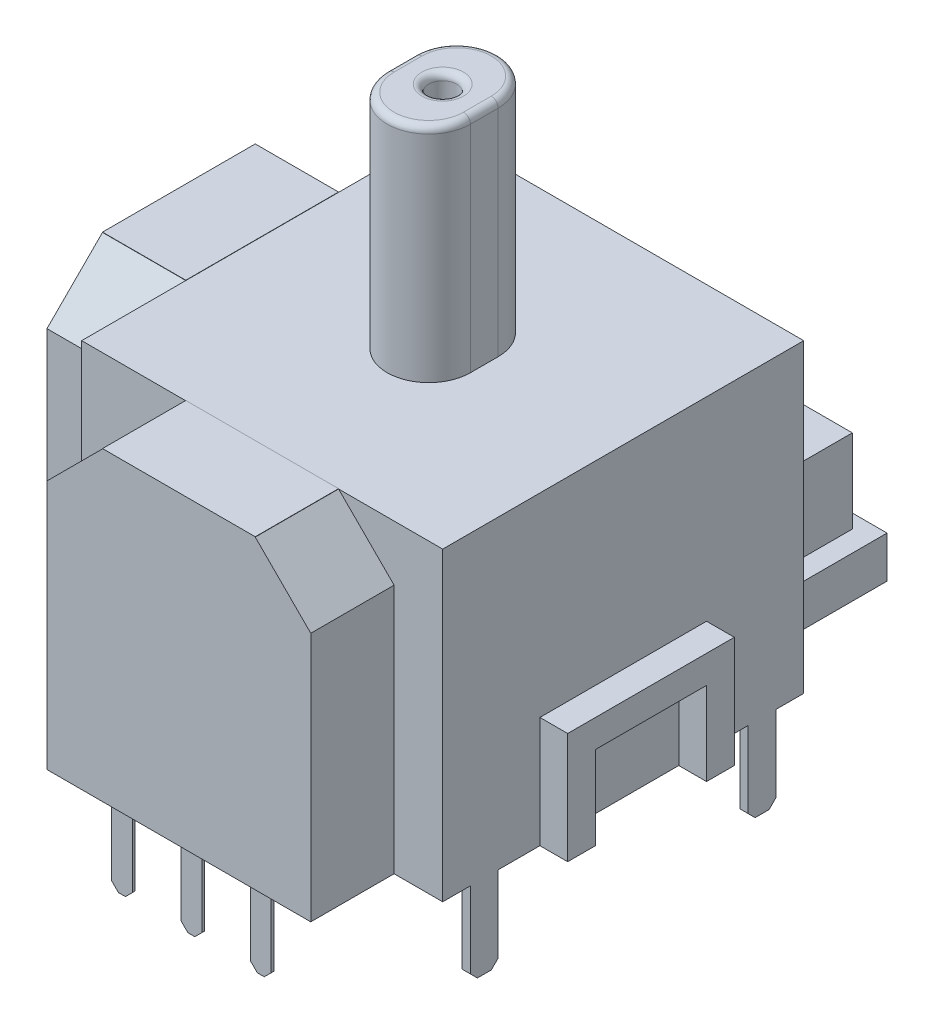
from build123d import *

# Parameters (mm, degrees)
SKETCH2_W           = 13
SKETCH2_H           = 11
BOSS_EXTRUDE1_DEPTH = 6.5
BOSS_EXTRUDE2_DEPTH = 1
SKETCH4_W           = 9.5
SKETCH4_H           = 11
BOSS_EXTRUDE3_DEPTH = 3
CHAMFER1_SIZE       = 2
SKETCH5_W           = 9.5
SKETCH5_H           = 11
BOSS_EXTRUDE4_DEPTH = 3
CHAMFER2_SIZE       = 2
SKETCH6_W           = 9
SKETCH6_H           = 1.5
BOSS_EXTRUDE5_DEPTH = 5
SKETCH7_W           = 7.5
SKETCH7_H           = 3
BOSS_EXTRUDE6_DEPTH = 4.5
SKETCH8_R           = 0.5
BOSS_EXTRUDE7_DEPTH = 8
FILLET2_R           = 0.25
SKETCH9_W           = 3
SKETCH9_H           = 5.5
SKETCH9_W_2         = 5.5
SKETCH9_H_2         = 3
BOSS_EXTRUDE8_DEPTH = 0.01
SKETCH10_W          = 0.3
SKETCH10_H          = 1
SKETCH10_W_2        = 0.1
SKETCH10_H_2        = 0.75
SKETCH10_W_3        = 0.75
SKETCH10_H_3        = 0.1
SKETCH10_W_4        = 0.25
SKETCH10_H_4        = 0.25
BOSS_EXTRUDE9_DEPTH = 3
CHAMFER3_SIZE       = 0.25
CHAMFER4_SIZE       = 0.1


with BuildPart() as part:
    # Sketch2 → Boss-Extrude1 (new, symmetric)
    with BuildSketch(Plane(origin=(0, 0, 0), x_dir=(0, 0, -1), z_dir=(1, 0, 0))):
        Rectangle(SKETCH2_W, SKETCH2_H)
    extrude(amount=BOSS_EXTRUDE1_DEPTH, both=True)

    # Sketch3 → Boss-Extrude2 (add)
    with BuildSketch(Plane(origin=(6.5, 0, 0), x_dir=(0, 0, -1), z_dir=(1, 0, 0))):
        Polygon((3, -1.5), (-3, -1.5), (-3, -5.5), (-2, -5.5), (-2, -2.5), (2, -2.5), (2, -5.5), (3, -5.5), align=None)
    extrude(amount=BOSS_EXTRUDE2_DEPTH)

    # Sketch4 → Boss-Extrude3 (add)
    with BuildSketch(Plane.XY.offset(6.5)):
        Rectangle(SKETCH4_W, SKETCH4_H)
    extrude(amount=BOSS_EXTRUDE3_DEPTH)

    # Chamfer1
    chamfer1_edges = [part.edges().sort_by_distance(p)[0] for p in [
        (4.75, 5.5, 8),
        (-4.75, 5.5, 8),
    ]]
    chamfer(chamfer1_edges, length=CHAMFER1_SIZE)

    # Sketch5 → Boss-Extrude4 (add)
    with BuildSketch(Plane.ZY.offset(6.5)):
        Rectangle(SKETCH5_W, SKETCH5_H)
    extrude(amount=BOSS_EXTRUDE4_DEPTH)

    # Chamfer2
    chamfer2_edges = [part.edges().sort_by_distance(p)[0] for p in [
        (-8, 5.5, -4.75),
        (-8, 5.5, 4.75),
    ]]
    chamfer(chamfer2_edges, length=CHAMFER2_SIZE)

    # Sketch6 → Boss-Extrude5 (add)
    with BuildSketch(Plane(origin=(0, 0, -6.5), x_dir=(-1, 0, 0), z_dir=(0, 0, -1))):
        with Locations((0, -4.75)):
            Rectangle(SKETCH6_W, SKETCH6_H)
    extrude(amount=BOSS_EXTRUDE5_DEPTH)

    # Sketch7 → Boss-Extrude6 (add)
    with BuildSketch(Plane(origin=(0, 0, -6.5), x_dir=(-1, 0, 0), z_dir=(0, 0, -1))):
        with Locations((0, -2.5)):
            Rectangle(SKETCH7_W, SKETCH7_H)
    extrude(amount=BOSS_EXTRUDE6_DEPTH)

    # Sketch8 → Boss-Extrude7 (add)
    with BuildSketch(Plane(origin=(0, 5.5, 0), x_dir=(1, 0, 0), z_dir=(0, 1, 0))):
        with BuildLine():
            Line((1.5, 0.5), (1.5, -0.5))
            ThreePointArc((1.5, -0.5), (0, -2), (-1.5, -0.5))
            Line((-1.5, -0.5), (-1.5, 0.5))
            ThreePointArc((-1.5, 0.5), (0, 2), (1.5, 0.5))
        make_face()
        Circle(SKETCH8_R, mode=Mode.SUBTRACT)
    extrude(amount=BOSS_EXTRUDE7_DEPTH)

    # Fillet2
    fillet2_edges = [part.edges().sort_by_distance(p)[0] for p in [
        (-0.5, 13.5, 0),
        (1.5, 13.5, 0),
        (0, 13.5, 2),
        (-1.5, 13.5, 0),
        (0, 13.5, -2),
    ]]
    fillet(fillet2_edges, radius=FILLET2_R)

    # Sketch9 → Boss-Extrude8 (add)
    with BuildSketch(Plane(origin=(0, 5.5, 0), x_dir=(1, 0, 0), z_dir=(0, 1, 0))):
        with Locations((-8, 0)):
            Rectangle(SKETCH9_W, SKETCH9_H)
        with Locations((0, -8)):
            Rectangle(SKETCH9_W_2, SKETCH9_H_2)
    extrude(amount=BOSS_EXTRUDE8_DEPTH)

    # Sketch10 → Boss-Extrude9 (add)
    with BuildSketch(Plane.XZ.offset(5.5)):
        with Locations((-6.35, -5)):
            Rectangle(SKETCH10_W, SKETCH10_H)
        with Locations((6.35, -5)):
            Rectangle(SKETCH10_W, SKETCH10_H)
        with Locations((-6.35, 5)):
            Rectangle(SKETCH10_W, SKETCH10_H)
        with Locations((6.35, 5)):
            Rectangle(SKETCH10_W, SKETCH10_H)
        with Locations((-9.15, 0)):
            Rectangle(SKETCH10_W_2, SKETCH10_H_2)
        with Locations((-9.15, -2.5)):
            Rectangle(SKETCH10_W_2, SKETCH10_H_2)
        with Locations((-9.15, 2.5)):
            Rectangle(SKETCH10_W_2, SKETCH10_H_2)
        with Locations((0, 9)):
            Rectangle(SKETCH10_W_3, SKETCH10_H_3)
        with Locations((-2.5, 9)):
            Rectangle(SKETCH10_W_3, SKETCH10_H_3)
        with Locations((2.5, 9)):
            Rectangle(SKETCH10_W_3, SKETCH10_H_3)
        with Locations((-3.1, -5.5)):
            Rectangle(SKETCH10_W_4, SKETCH10_H_4)
        with Locations((2.9, -5.5)):
            Rectangle(SKETCH10_W_4, SKETCH10_H_4)
        with Locations((2.9, -9.5)):
            Rectangle(SKETCH10_W_4, SKETCH10_H_4)
        with Locations((-3.1, -9.5)):
            Rectangle(SKETCH10_W_4, SKETCH10_H_4)
    extrude(amount=BOSS_EXTRUDE9_DEPTH)

    # Chamfer3
    chamfer3_edges = [part.edges().sort_by_distance(p)[0] for p in [
        (-9.15, -8.5, 2.875),
        (-9.15, -8.5, 2.125),
        (-9.15, -8.5, 0.375),
        (-9.15, -8.5, -0.375),
        (-9.15, -8.5, -2.875),
        (-9.15, -8.5, -2.125),
        (-6.35, -8.5, 5.5),
        (-6.35, -8.5, 4.5),
        (6.35, -8.5, 5.5),
        (6.35, -8.5, 4.5),
        (6.35, -8.5, -5.5),
        (6.35, -8.5, -4.5),
        (-6.35, -8.5, -4.5),
        (-6.35, -8.5, -5.5),
        (2.875, -8.5, 9),
        (2.125, -8.5, 9),
        (0.375, -8.5, 9),
        (-0.375, -8.5, 9),
        (-2.125, -8.5, 9),
        (-2.875, -8.5, 9),
    ]]
    chamfer(chamfer3_edges, length=CHAMFER3_SIZE)

    # Chamfer4
    chamfer4_edges = [part.edges().sort_by_distance(p)[0] for p in [
        (2.9, -8.5, -5.625),
        (2.775, -8.5, -5.5),
        (2.9, -8.5, -5.375),
        (3.025, -8.5, -5.5),
        (-3.1, -8.5, -5.625),
        (-3.225, -8.5, -5.5),
        (-3.1, -8.5, -5.375),
        (-2.975, -8.5, -5.5),
        (-3.1, -8.5, -9.625),
        (-3.225, -8.5, -9.5),
        (-3.1, -8.5, -9.375),
        (-2.975, -8.5, -9.5),
        (2.9, -8.5, -9.625),
        (2.775, -8.5, -9.5),
        (2.9, -8.5, -9.375),
        (3.025, -8.5, -9.5),
    ]]
    chamfer(chamfer4_edges, length=CHAMFER4_SIZE)


solid = part.part
